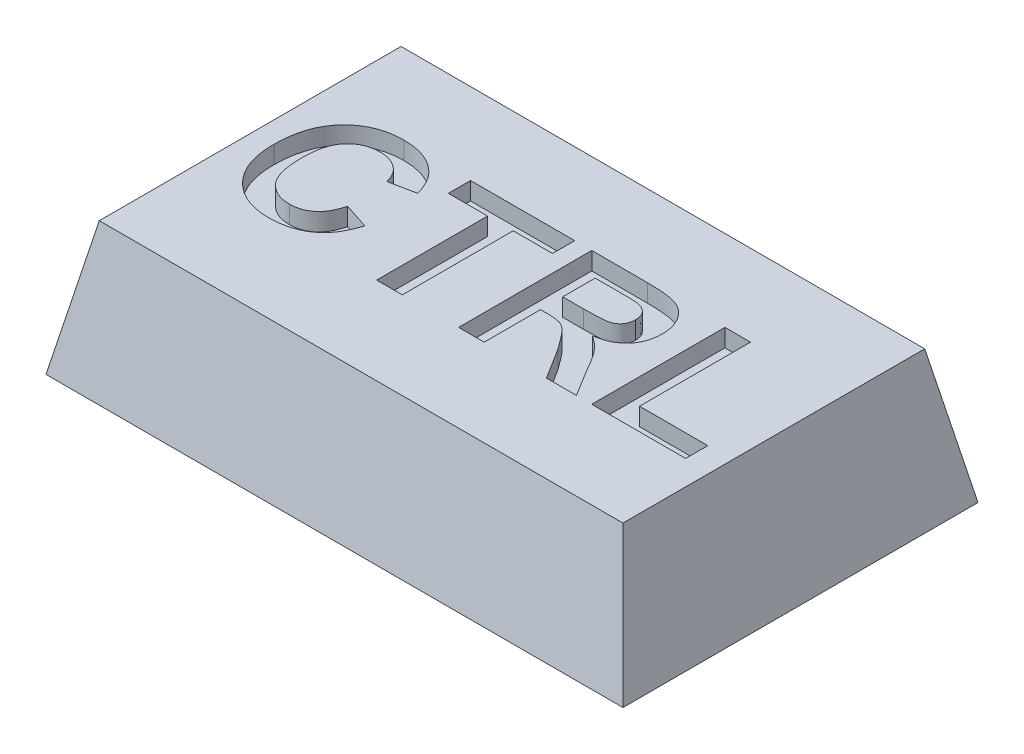
from build123d import *

# Parameters (mm, degrees)
SKETCH1_W               = 13
SKETCH1_H               = 8
BOSS_EXTRUDE1_DEPTH     = 3
CUT_EXTRUDE1_DEPTH      = 16.556349186
CUT_EXTRUDE1_DEPTH_BACK = 16.556349186
CUT_EXTRUDE2_DEPTH      = 16.556349186
CUT_EXTRUDE2_DEPTH_BACK = 16.556349186
SKETCH4_R               = 1.8
CUT_EXTRUDE3_DEPTH      = 0.8
SKETCH5_W               = 8
SKETCH5_H               = 1.1
BOSS_EXTRUDE2_DEPTH     = 2
FILLET1_R               = 4
CUT_EXTRUDE4_DEPTH      = 0.4


with BuildPart() as part:
    # Sketch1 → Boss-Extrude1 (new body)
    with BuildSketch(Plane(origin=(0, 0, 0), x_dir=(1, 0, 0), z_dir=(0, 1, 0))):
        with Locations((6.5, 4)):
            Rectangle(SKETCH1_W, SKETCH1_H)
    extrude(amount=BOSS_EXTRUDE1_DEPTH)

    # Sketch2 → Cut-Extrude1 (cut, two sides: drawn at the far end of the back side and taken through both)
    with BuildSketch(Plane.XY.offset(-CUT_EXTRUDE1_DEPTH_BACK)):
        Polygon((0, 0), (0.6, 3), (0, 3), align=None)
        Polygon((13, 0), (12.4, 3), (13, 3), align=None)
    extrude(amount=CUT_EXTRUDE1_DEPTH + CUT_EXTRUDE1_DEPTH_BACK, mode=Mode.SUBTRACT)

    # Sketch3 → Cut-Extrude2 (cut, two sides: drawn at the far end of the back side and taken through both)
    with BuildSketch(Plane(origin=(0, 0, 0), x_dir=(0, 0, -1), z_dir=(1, 0, 0)).offset(-CUT_EXTRUDE2_DEPTH_BACK)):
        Polygon((0, 0), (0.6, 3), (0, 3), align=None)
        Polygon((8, 3), (7.4, 3), (8, 0), align=None)
    extrude(amount=CUT_EXTRUDE2_DEPTH + CUT_EXTRUDE2_DEPTH_BACK, mode=Mode.SUBTRACT)

    # Sketch4 → Cut-Extrude3 (cut)
    with BuildSketch(Plane.XZ):
        with Locations(Location((6.50000125, -3.75, 0), (0, 0, 270))):
            Circle(SKETCH4_R)
    extrude(amount=-CUT_EXTRUDE3_DEPTH, mode=Mode.SUBTRACT)

    # Sketch5 → Boss-Extrude2 (add)
    with BuildSketch(Plane.XZ):
        with Locations((6.500011, -7.45)):
            Rectangle(SKETCH5_W, SKETCH5_H)
    extrude(amount=BOSS_EXTRUDE2_DEPTH)

    # Fillet1
    # the kernel refuses this fillet: 4 mm, written as the material it takes off along each edge
    with BuildSketch(Plane(origin=(10.500011, -2, -16.660254038), x_dir=(0, 1, 0), z_dir=(0, 0, 1)), Plane(origin=(2.500011, -2, 1.760254038), x_dir=(0, 1, 0), z_dir=(0, 0, -1))) as fillet1_piece_1:
        with BuildLine():
            CenterArc((4, 3.464101615), FILLET1_R, 180, 60)
            Line((0, 3.464101615), (-0.08, 3.464101615))
            Line((-0.08, 3.464101615), (-0.08, 0))
            Line((-0.08, 0), (0, -0.08))
            ThreePointArc((0, -0.08), (1, -0.08), (1.96, -0.069282032))
            Line((1.96, -0.069282032), (2, 0))
        make_face()
    extrude(amount=18.420508076, mode=Mode.SUBTRACT)

    # Sketch6 → Cut-Extrude4 (cut)
    # profile 1 of 4: a face of its own
    with BuildSketch(Plane(origin=(0, 3, 0), x_dir=(1, 0, 0), z_dir=(0, 1, 0))):
        with BuildLine():
            Line((3.114763417, 3.682334856), (3.691686494, 3.490027164))
            add(Edge.make_bspline(
                [(3.691686494, 3.490027164), (3.679961641, 3.452199771), (3.657000691, 3.378121836), (3.614840538, 3.271950566), (3.566631057, 3.17355681), (3.514105967, 3.081788933), (3.453998837, 2.999017599), (3.389674784, 2.922502296), (3.319221195, 2.853854584), (3.242985709, 2.792927875), (3.161702135, 2.739049061), (3.074426278, 2.693500424), (2.982460606, 2.654270563), (2.884872536, 2.622486105), (2.782309727, 2.597031579), (2.674290947, 2.580218726), (2.561321499, 2.568819056), (2.484184337, 2.567583054), (2.444691302, 2.566950241)],
                knots=[0, 0, 0, 0, 1.126640671, 2.206316847, 3.246446654, 4.24268115, 5.210795778, 6.153057602, 7.084219323, 8.004711971, 8.926421631, 9.854560063, 10.802134612, 11.768317461, 12.772025444, 13.805668576, 14.876536225, 16, 16, 16, 16], degree=3))
            add(Edge.make_bspline(
                [(2.444691302, 2.566950241), (2.39594522, 2.567958204), (2.300060219, 2.569940898), (2.159837488, 2.589899449), (2.026211566, 2.621039548), (1.898991292, 2.664152473), (1.779025843, 2.721255434), (1.665220727, 2.789999995), (1.558404176, 2.871781783), (1.458950921, 2.965222461), (1.368595233, 3.069608709), (1.290460938, 3.184376454), (1.223697885, 3.307908898), (1.169736544, 3.440795057), (1.127542416, 3.582898481), (1.097985342, 3.734022688), (1.079490404, 3.894215284), (1.07738329, 4.003997359), (1.076301879, 4.060339664)],
                knots=[0, 0, 0, 0, 1.025049111, 2.016302254, 2.973197159, 3.90886983, 4.83646737, 5.763135642, 6.70136783, 7.661478232, 8.629732022, 9.600038443, 10.576877021, 11.5787097, 12.612181225, 13.690866959, 14.814907849, 16, 16, 16, 16], degree=3))
            add(Edge.make_bspline(
                [(1.076301879, 4.060339664), (1.077378416, 4.119685986), (1.079478544, 4.235459834), (1.09800813, 4.403785096), (1.126774207, 4.562421842), (1.169039649, 4.710386463), (1.222208021, 4.84872028), (1.289052131, 4.976050067), (1.366407039, 5.094073475), (1.456352649, 5.200627283), (1.556259151, 5.295232655), (1.663321324, 5.37888938), (1.778537964, 5.449071375), (1.901278577, 5.506462538), (2.031707782, 5.550874644), (2.169568928, 5.582854847), (2.314974812, 5.601469381), (2.414389536, 5.604079668), (2.465123994, 5.605411779)],
                knots=[0, 0, 0, 0, 1.212648312, 2.365655595, 3.457000981, 4.504219827, 5.506356588, 6.480637568, 7.437950897, 8.385265166, 9.323599949, 10.245787653, 11.157260172, 12.074946661, 13.00980897, 13.968233668, 14.963125779, 16, 16, 16, 16], degree=3))
            add(Edge.make_bspline(
                [(2.465123994, 5.605411779), (2.509432357, 5.604295323), (2.596304799, 5.602106363), (2.723520669, 5.587234486), (2.844085713, 5.561135336), (2.958651622, 5.525907287), (3.066566226, 5.479415633), (3.168022853, 5.42260331), (3.263370233, 5.355770915), (3.320818993, 5.303566899), (3.349739379, 5.277286779)],
                knots=[0, 0, 0, 0, 1.098510076, 2.153775193, 3.169777012, 4.153122333, 5.120892526, 6.076995459, 7.031936742, 8, 8, 8, 8], degree=3))
            add(Edge.make_bspline(
                [(3.349739379, 5.277286779), (3.366501255, 5.260564472), (3.400418731, 5.226727063), (3.445708082, 5.169599928), (3.488648012, 5.108102558), (3.528556981, 5.041185886), (3.56417364, 4.968344222), (3.597211896, 4.890696182), (3.627628978, 4.80794246), (3.644544373, 4.750350982), (3.653224955, 4.720796394)],
                knots=[0, 0, 0, 0, 0.885292881, 1.791380647, 2.722937556, 3.69093542, 4.703306561, 5.754477758, 6.847650944, 8, 8, 8, 8], degree=3))
            Line((3.653224955, 4.720796394), (3.076301879, 4.605411779))
            add(Edge.make_bspline(
                [(3.076301879, 4.605411779), (3.07139827, 4.624334889), (3.061739446, 4.661608452), (3.042196132, 4.715168515), (3.019778409, 4.765992231), (2.991993695, 4.81283475), (2.962479145, 4.857779964), (2.927535582, 4.898832166), (2.889394626, 4.937067243), (2.847781515, 4.97208841), (2.803192338, 5.003188008), (2.756485594, 5.031144611), (2.706812368, 5.053965934), (2.654833438, 5.07242833), (2.600755831, 5.087907659), (2.544098089, 5.097469962), (2.485346838, 5.10481072), (2.445317529, 5.105208489), (2.424859571, 5.105411779)],
                knots=[0, 0, 0, 0, 1.051226935, 2.070641259, 3.064374968, 4.034983734, 4.997599858, 5.953980297, 6.92954377, 7.901109626, 8.875958313, 9.851998019, 10.826131395, 11.811470594, 12.818270757, 13.847890818, 14.900111925, 16, 16, 16, 16], degree=3))
            add(Edge.make_bspline(
                [(2.424859571, 5.105411779), (2.396764359, 5.104844384), (2.341930913, 5.103736998), (2.26178343, 5.091390397), (2.185393769, 5.074159438), (2.113070006, 5.047847852), (2.045260023, 5.014195552), (1.981193156, 4.973287418), (1.921221036, 4.925298669), (1.865323396, 4.869660798), (1.815162862, 4.805367843), (1.771064592, 4.732287064), (1.734481125, 4.649588757), (1.704781167, 4.558084452), (1.681403916, 4.457556551), (1.664710719, 4.347876122), (1.655478879, 4.228968133), (1.653992476, 4.146693318), (1.653224955, 4.104209856)],
                knots=[0, 0, 0, 0, 0.938194206, 1.831074359, 2.704771284, 3.551924377, 4.396294915, 5.230222094, 6.087631332, 6.958733431, 7.860107878, 8.806247581, 9.804197948, 10.875520245, 12.017191412, 13.250061517, 14.580040491, 16, 16, 16, 16], degree=3))
            add(Edge.make_bspline(
                [(1.653224955, 4.104209856), (1.653984918, 4.059123158), (1.655449249, 3.972248036), (1.66467913, 3.846938708), (1.681479073, 3.731687275), (1.70454564, 3.626289209), (1.734395267, 3.530809066), (1.770916868, 3.445412073), (1.814334082, 3.36999822), (1.864579361, 3.304617725), (1.920382418, 3.248456081), (1.980231869, 3.200169854), (2.043774616, 3.15888532), (2.111393029, 3.124919067), (2.183344293, 3.099223975), (2.259037074, 3.080589444), (2.338749102, 3.068743176), (2.393366789, 3.067556262), (2.421253802, 3.066950241)],
                knots=[0, 0, 0, 0, 1.475208372, 2.842499301, 4.107722225, 5.282836115, 6.369007568, 7.375918121, 8.315702116, 9.208439171, 10.065831443, 10.90006451, 11.71996243, 12.54067204, 13.369972975, 14.214060185, 15.088124569, 16, 16, 16, 16], degree=3))
            add(Edge.make_bspline(
                [(2.421253802, 3.066950241), (2.441900329, 3.067465339), (2.482498659, 3.068478203), (2.54250612, 3.074906774), (2.600101045, 3.087174776), (2.655565343, 3.103396988), (2.709114509, 3.123751078), (2.759931745, 3.149861283), (2.809016856, 3.179871086), (2.855351366, 3.215040275), (2.899555718, 3.254524405), (2.939872709, 3.300158218), (2.977270066, 3.350845238), (3.011273346, 3.406924207), (3.043018707, 3.467915109), (3.070027822, 3.534768215), (3.095189234, 3.606403148), (3.108124727, 3.656582206), (3.114763417, 3.682334856)],
                knots=[0, 0, 0, 0, 0.980177776, 1.927374078, 2.859849964, 3.771585772, 4.668674471, 5.574490016, 6.479656464, 7.396337719, 8.332153134, 9.288470092, 10.28125149, 11.318486971, 12.398724812, 13.541284404, 14.738150009, 16, 16, 16, 16], degree=3))
        make_face()
    # profile 2 of 4: a face of its own
    with BuildSketch(Plane(origin=(0, 3, 0), x_dir=(1, 0, 0), z_dir=(0, 1, 0))):
        Polygon((4.883994186, 2.566950241), (4.883994186, 5.066950241), (3.999378802, 5.066950241), (3.999378802, 5.566950241), (6.345532648, 5.566950241), (6.345532648, 5.066950241), (5.460917263, 5.066950241), (5.460917263, 2.566950241), align=None)
    # profile 3 of 4: a face of its own
    with BuildSketch(Plane(origin=(0, 3, 0), x_dir=(1, 0, 0), z_dir=(0, 1, 0))):
        with BuildLine():
            Line((6.730148032, 2.566950241), (6.730148032, 5.566950241))
            Line((6.730148032, 5.566950241), (7.989162455, 5.566950241))
            add(Edge.make_bspline(
                [(7.989162455, 5.566950241), (8.027425148, 5.566714429), (8.10116436, 5.566259975), (8.207805646, 5.562946013), (8.30615285, 5.556003068), (8.396642241, 5.548140126), (8.478839191, 5.536700052), (8.553068692, 5.522994956), (8.619205774, 5.507112639), (8.678215416, 5.488090989), (8.732020222, 5.46632005), (8.782142039, 5.440406508), (8.829131971, 5.410045608), (8.873711736, 5.376283807), (8.916070113, 5.339069229), (8.95504586, 5.297416992), (8.991318037, 5.251947312), (9.024857377, 5.203038499), (9.054403437, 5.150906515), (9.081400778, 5.097225591), (9.103377632, 5.04142448), (9.121530314, 4.983766047), (9.136030956, 4.924375477), (9.146095627, 4.863101777), (9.152378893, 4.800055854), (9.152939801, 4.757470161), (9.153224955, 4.735820433)],
                knots=[0, 0, 0, 0, 1.675828044, 3.229627355, 4.67171229, 5.993455049, 7.206927059, 8.304770529, 9.29850117, 10.183580433, 11.017754134, 11.837875825, 12.650738409, 13.464925643, 14.285328857, 15.117007378, 15.959673368, 16.830859064, 17.711229498, 18.58228265, 19.460420693, 20.334473227, 21.228207035, 22.135446768, 23.052097822, 24, 24, 24, 24], degree=3))
            add(Edge.make_bspline(
                [(9.153224955, 4.735820433), (9.152696037, 4.708547835), (9.151662383, 4.65524966), (9.142150158, 4.577131124), (9.128022075, 4.502494439), (9.1078826, 4.431236203), (9.080191233, 4.364194513), (9.048044941, 4.300430213), (9.009705087, 4.240159591), (8.965432149, 4.183980138), (8.915265763, 4.131842124), (8.85898608, 4.08481851), (8.796994919, 4.042725516), (8.728917272, 4.005805876), (8.655227167, 3.974243584), (8.57560506, 3.947688033), (8.490411399, 3.926074774), (8.431150736, 3.915905089), (8.400821109, 3.910700241)],
                knots=[0, 0, 0, 0, 1.05911256, 2.069797862, 3.05271628, 4.008392045, 4.940519534, 5.866323021, 6.779546087, 7.71056835, 8.640711998, 9.585328432, 10.554502533, 11.547017206, 12.589327225, 13.664782803, 14.804835066, 16, 16, 16, 16], degree=3))
            add(Edge.make_bspline(
                [(8.400821109, 3.910700241), (8.430153265, 3.891273278), (8.487560289, 3.853252066), (8.56698704, 3.790630653), (8.638293416, 3.724904637), (8.692283008, 3.666456974), (8.733768445, 3.615058534), (8.76717131, 3.570104963), (8.803201654, 3.518369923), (8.841506099, 3.459825383), (8.883217021, 3.394989323), (8.926783116, 3.322869329), (8.973116067, 3.244168868), (9.004267632, 3.189192612), (9.020412455, 3.160700241)],
                knots=[0, 0, 0, 0, 1.285445069, 2.515791127, 3.691898215, 4.826622834, 5.420063933, 6.105349801, 6.873086501, 7.723915395, 8.66222816, 9.690593598, 10.803111229, 12, 12, 12, 12], degree=3))
            Line((9.020412455, 3.160700241), (9.383994186, 2.566950241))
            Line((9.383994186, 2.566950241), (8.70971534, 2.566950241))
            Line((8.70971534, 2.566950241), (8.283032648, 3.247839664))
            add(Edge.make_bspline(
                [(8.283032648, 3.247839664), (8.263436835, 3.275108794), (8.226024399, 3.327171169), (8.172017237, 3.401153494), (8.122605477, 3.467011051), (8.079104131, 3.525697749), (8.039312048, 3.575549681), (8.004437476, 3.617435595), (7.975190764, 3.652254301), (7.942098036, 3.686778551), (7.903598161, 3.722259863), (7.85593839, 3.756661015), (7.806996228, 3.78408525), (7.75455861, 3.805010586), (7.69391609, 3.81960112), (7.621014176, 3.828897146), (7.533560664, 3.835755648), (7.470349295, 3.836032035), (7.43627784, 3.83618101)],
                knots=[0, 0, 0, 0, 1.465447777, 2.797841088, 3.997266218, 5.05856206, 5.985598736, 6.780315439, 7.437430484, 7.969193402, 8.866571936, 9.718200644, 10.52825214, 11.309096006, 12.174169268, 13.242355782, 14.513606761, 16, 16, 16, 16], degree=3))
            Line((7.43627784, 3.83618101), (7.307071109, 3.83618101))
            Line((7.307071109, 3.83618101), (7.307071109, 2.566950241))
            Line((7.307071109, 2.566950241), (6.730148032, 2.566950241))
        make_face()
        with BuildLine():
            Line((7.307071109, 4.33618101), (7.771614379, 4.33618101))
            add(Edge.make_bspline(
                [(7.771614379, 4.33618101), (7.807473482, 4.336257858), (7.875791132, 4.336404267), (7.972940191, 4.338524941), (8.059727013, 4.340324879), (8.135632244, 4.344847301), (8.20099549, 4.349329447), (8.255554547, 4.355154611), (8.299769089, 4.362039767), (8.343931986, 4.372744376), (8.389169797, 4.391395045), (8.437384745, 4.417959087), (8.478592867, 4.452419853), (8.514288619, 4.492259984), (8.541519477, 4.539095682), (8.56284768, 4.590840362), (8.57366153, 4.648643838), (8.575403321, 4.688709175), (8.576301879, 4.709378125)],
                knots=[0, 0, 0, 0, 1.697953026, 3.23488743, 4.60134403, 5.807846676, 6.835100678, 7.703488618, 8.405232423, 8.952775585, 9.851109663, 10.713519226, 11.549115941, 12.382556273, 13.233359028, 14.101746968, 15.020727134, 16, 16, 16, 16], degree=3))
            add(Edge.make_bspline(
                [(8.576301879, 4.709378125), (8.575279939, 4.732500619), (8.573308271, 4.777111743), (8.557759416, 4.840593797), (8.530619523, 4.896671451), (8.493346148, 4.945437292), (8.446555299, 4.986615871), (8.390822223, 5.019302699), (8.326560978, 5.043646493), (8.280211619, 5.052636609), (8.255989379, 5.057334856)],
                knots=[0, 0, 0, 0, 1.062977961, 2.050844577, 2.982300261, 3.90936959, 4.856017476, 5.831122378, 6.86654153, 8, 8, 8, 8], degree=3))
            add(Edge.make_bspline(
                [(8.255989379, 5.057334856), (8.247982692, 5.058214619), (8.229005166, 5.060299841), (8.195493103, 5.061639088), (8.152643632, 5.063697656), (8.099938101, 5.064538947), (8.037847381, 5.066013656), (7.966124569, 5.066284449), (7.884997535, 5.067149616), (7.827704469, 5.067019132), (7.797455725, 5.066950241)],
                knots=[0, 0, 0, 0, 0.42127143, 0.998501726, 1.753681744, 2.66564073, 3.755712164, 5.002818897, 6.417592707, 8, 8, 8, 8], degree=3))
            Line((7.797455725, 5.066950241), (7.307071109, 5.066950241))
            Line((7.307071109, 5.066950241), (7.307071109, 4.33618101))
        make_face(mode=Mode.SUBTRACT)
    # profile 4 of 4: a face of its own
    with BuildSketch(Plane(origin=(0, 3, 0), x_dir=(1, 0, 0), z_dir=(0, 1, 0))):
        Polygon((9.730148032, 2.566950241), (9.730148032, 5.566950241), (10.307071109, 5.566950241), (10.307071109, 3.066950241), (11.845532648, 3.066950241), (11.845532648, 2.566950241), align=None)
    extrude(amount=-CUT_EXTRUDE4_DEPTH, mode=Mode.SUBTRACT)


solid = part.part
